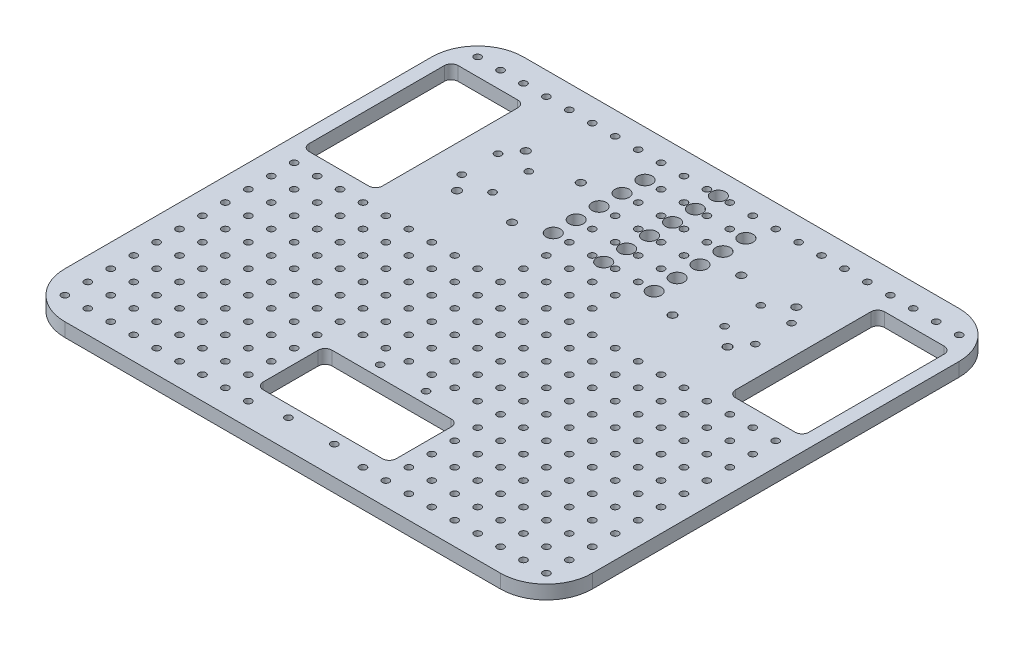
from build123d import *

# Parameters (mm, degrees)
SKETCH_1_W          = 230
SKETCH_1_H          = 200
SKETCH_1_R          = 1.73
EXTRUDE_1_DEPTH     = 6
FILLET_1_R          = 20
SKETCH_2_R          = 1.5
SKETCH_2_W          = 32
SKETCH_2_H          = 65
SKETCH_2_W_2        = 58
SKETCH_2_H_2        = 30
CUT_EXTRUDE_1_DEPTH = 10
FILLET_2_R          = 3
SKETCH_3_R          = 1.5
SKETCH_3_R_2        = 3.1
CUT_EXTRUDE_2_DEPTH = 10
SKETCH_4_R          = 1.5
CUT_EXTRUDE_3_DEPTH = 10


with BuildPart() as part:
    # Эскиз1 → Бобышка-Вытянуть1 (new body)
    with BuildSketch(Plane(origin=(0, 0, 0), x_dir=(1, 0, 0), z_dir=(0, 1, 0))):
        with Locations((115, 100)):
            Rectangle(SKETCH_1_W, SKETCH_1_H)
        with Locations((80, 135)):
            Circle(SKETCH_1_R, mode=Mode.SUBTRACT)
        with Locations((80, 165)):
            Circle(SKETCH_1_R, mode=Mode.SUBTRACT)
        with Locations((56, 165)):
            Circle(SKETCH_1_R, mode=Mode.SUBTRACT)
        with Locations((56, 135)):
            Circle(SKETCH_1_R, mode=Mode.SUBTRACT)
        with Locations((150, 135)):
            Circle(SKETCH_1_R, mode=Mode.SUBTRACT)
        with Locations((174, 135)):
            Circle(SKETCH_1_R, mode=Mode.SUBTRACT)
        with Locations((150, 165)):
            Circle(SKETCH_1_R, mode=Mode.SUBTRACT)
        with Locations((174, 165)):
            Circle(SKETCH_1_R, mode=Mode.SUBTRACT)
    extrude(amount=EXTRUDE_1_DEPTH)

    # Скругление1
    fillet_1_edges = [part.edges().sort_by_distance(p)[0] for p in [
        (0, 3, 0),
        (230, 3, 0),
        (230, 3, -200),
        (0, 3, -200),
    ]]
    fillet(fillet_1_edges, radius=FILLET_1_R)

    # Эскиз2 → Вырез-Вытянуть1 (cut)
    with BuildSketch(Plane(origin=(0, 6, 0), x_dir=(1, 0, 0), z_dir=(0, 1, 0))):
        with Locations((105, 12.5)):
            Circle(SKETCH_2_R)
        with Locations((125, 12.5)):
            Circle(SKETCH_2_R)
        with Locations((105, 52.5)):
            Circle(SKETCH_2_R)
        with Locations((125, 52.5)):
            Circle(SKETCH_2_R)
        with Locations((208, 150)):
            Rectangle(SKETCH_2_W, SKETCH_2_H)
        with Locations((22, 150)):
            Rectangle(SKETCH_2_W, SKETCH_2_H)
        with Locations((115, 32.5)):
            Rectangle(SKETCH_2_W_2, SKETCH_2_H_2)
    extrude(amount=-CUT_EXTRUDE_1_DEPTH, mode=Mode.SUBTRACT)

    # Скругление2
    fillet_2_edges = [part.edges().sort_by_distance(p)[0] for p in [
        (224, 3, -117.5),
        (224, 3, -182.5),
        (192, 3, -182.5),
        (192, 3, -117.5),
        (6, 3, -117.5),
        (38, 3, -117.5),
        (38, 3, -182.5),
        (6, 3, -182.5),
        (86, 3, -17.5),
        (144, 3, -17.5),
        (144, 3, -47.5),
        (86, 3, -47.5),
    ]]
    fillet(fillet_2_edges, radius=FILLET_2_R)

    # Эскиз3 → Вырез-Вытянуть2 (cut)
    with BuildSketch(Plane(origin=(0, 6, 0), x_dir=(1, 0, 0), z_dir=(0, 1, 0))):
        with Locations((10, 10)):
            Circle(SKETCH_3_R)
        with Locations((20, 10)):
            Circle(SKETCH_3_R)
        with Locations((30, 10)):
            Circle(SKETCH_3_R)
        with Locations((40, 10)):
            Circle(SKETCH_3_R)
        with Locations((50, 10)):
            Circle(SKETCH_3_R)
        with Locations((60, 10)):
            Circle(SKETCH_3_R)
        with Locations((70, 10)):
            Circle(SKETCH_3_R)
        with Locations((80, 10)):
            Circle(SKETCH_3_R)
        with Locations((90, 10)):
            Circle(SKETCH_3_R)
        with Locations((140, 10)):
            Circle(SKETCH_3_R)
        with Locations((150, 10)):
            Circle(SKETCH_3_R)
        with Locations((160, 10)):
            Circle(SKETCH_3_R)
        with Locations((170, 10)):
            Circle(SKETCH_3_R)
        with Locations((180, 10)):
            Circle(SKETCH_3_R)
        with Locations((190, 10)):
            Circle(SKETCH_3_R)
        with Locations((200, 10)):
            Circle(SKETCH_3_R)
        with Locations((210, 10)):
            Circle(SKETCH_3_R)
        with Locations((220, 10)):
            Circle(SKETCH_3_R)
        with Locations((20, 20)):
            Circle(SKETCH_3_R)
        with Locations((30, 20)):
            Circle(SKETCH_3_R)
        with Locations((40, 20)):
            Circle(SKETCH_3_R)
        with Locations((50, 20)):
            Circle(SKETCH_3_R)
        with Locations((60, 20)):
            Circle(SKETCH_3_R)
        with Locations((70, 20)):
            Circle(SKETCH_3_R)
        with Locations((80, 20)):
            Circle(SKETCH_3_R)
        with Locations((150, 20)):
            Circle(SKETCH_3_R)
        with Locations((160, 20)):
            Circle(SKETCH_3_R)
        with Locations((170, 20)):
            Circle(SKETCH_3_R)
        with Locations((180, 20)):
            Circle(SKETCH_3_R)
        with Locations((190, 20)):
            Circle(SKETCH_3_R)
        with Locations((200, 20)):
            Circle(SKETCH_3_R)
        with Locations((210, 20)):
            Circle(SKETCH_3_R)
        with Locations((220, 20)):
            Circle(SKETCH_3_R)
        with Locations((20, 30)):
            Circle(SKETCH_3_R)
        with Locations((30, 30)):
            Circle(SKETCH_3_R)
        with Locations((40, 30)):
            Circle(SKETCH_3_R)
        with Locations((50, 30)):
            Circle(SKETCH_3_R)
        with Locations((60, 30)):
            Circle(SKETCH_3_R)
        with Locations((70, 30)):
            Circle(SKETCH_3_R)
        with Locations((80, 30)):
            Circle(SKETCH_3_R)
        with Locations((150, 30)):
            Circle(SKETCH_3_R)
        with Locations((160, 30)):
            Circle(SKETCH_3_R)
        with Locations((170, 30)):
            Circle(SKETCH_3_R)
        with Locations((180, 30)):
            Circle(SKETCH_3_R)
        with Locations((190, 30)):
            Circle(SKETCH_3_R)
        with Locations((200, 30)):
            Circle(SKETCH_3_R)
        with Locations((210, 30)):
            Circle(SKETCH_3_R)
        with Locations((220, 30)):
            Circle(SKETCH_3_R)
        with Locations((20, 40)):
            Circle(SKETCH_3_R)
        with Locations((30, 40)):
            Circle(SKETCH_3_R)
        with Locations((40, 40)):
            Circle(SKETCH_3_R)
        with Locations((50, 40)):
            Circle(SKETCH_3_R)
        with Locations((60, 40)):
            Circle(SKETCH_3_R)
        with Locations((70, 40)):
            Circle(SKETCH_3_R)
        with Locations((80, 40)):
            Circle(SKETCH_3_R)
        with Locations((150, 40)):
            Circle(SKETCH_3_R)
        with Locations((160, 40)):
            Circle(SKETCH_3_R)
        with Locations((170, 40)):
            Circle(SKETCH_3_R)
        with Locations((180, 40)):
            Circle(SKETCH_3_R)
        with Locations((190, 40)):
            Circle(SKETCH_3_R)
        with Locations((200, 40)):
            Circle(SKETCH_3_R)
        with Locations((210, 40)):
            Circle(SKETCH_3_R)
        with Locations((220, 40)):
            Circle(SKETCH_3_R)
        with Locations((20, 50)):
            Circle(SKETCH_3_R)
        with Locations((30, 50)):
            Circle(SKETCH_3_R)
        with Locations((40, 50)):
            Circle(SKETCH_3_R)
        with Locations((50, 50)):
            Circle(SKETCH_3_R)
        with Locations((60, 50)):
            Circle(SKETCH_3_R)
        with Locations((70, 50)):
            Circle(SKETCH_3_R)
        with Locations((80, 50)):
            Circle(SKETCH_3_R)
        with Locations((150, 50)):
            Circle(SKETCH_3_R)
        with Locations((160, 50)):
            Circle(SKETCH_3_R)
        with Locations((170, 50)):
            Circle(SKETCH_3_R)
        with Locations((180, 50)):
            Circle(SKETCH_3_R)
        with Locations((190, 50)):
            Circle(SKETCH_3_R)
        with Locations((200, 50)):
            Circle(SKETCH_3_R)
        with Locations((210, 50)):
            Circle(SKETCH_3_R)
        with Locations((220, 50)):
            Circle(SKETCH_3_R)
        with Locations((20, 60)):
            Circle(SKETCH_3_R)
        with Locations((30, 60)):
            Circle(SKETCH_3_R)
        with Locations((40, 60)):
            Circle(SKETCH_3_R)
        with Locations((50, 60)):
            Circle(SKETCH_3_R)
        with Locations((60, 60)):
            Circle(SKETCH_3_R)
        with Locations((70, 60)):
            Circle(SKETCH_3_R)
        with Locations((80, 60)):
            Circle(SKETCH_3_R)
        with Locations((90, 60)):
            Circle(SKETCH_3_R)
        with Locations((100, 60)):
            Circle(SKETCH_3_R)
        with Locations((110, 60)):
            Circle(SKETCH_3_R)
        with Locations((120, 60)):
            Circle(SKETCH_3_R)
        with Locations((130, 60)):
            Circle(SKETCH_3_R)
        with Locations((140, 60)):
            Circle(SKETCH_3_R)
        with Locations((150, 60)):
            Circle(SKETCH_3_R)
        with Locations((160, 60)):
            Circle(SKETCH_3_R)
        with Locations((170, 60)):
            Circle(SKETCH_3_R)
        with Locations((180, 60)):
            Circle(SKETCH_3_R)
        with Locations((190, 60)):
            Circle(SKETCH_3_R)
        with Locations((200, 60)):
            Circle(SKETCH_3_R)
        with Locations((210, 60)):
            Circle(SKETCH_3_R)
        with Locations((220, 60)):
            Circle(SKETCH_3_R)
        with Locations((20, 70)):
            Circle(SKETCH_3_R)
        with Locations((30, 70)):
            Circle(SKETCH_3_R)
        with Locations((40, 70)):
            Circle(SKETCH_3_R)
        with Locations((50, 70)):
            Circle(SKETCH_3_R)
        with Locations((60, 70)):
            Circle(SKETCH_3_R)
        with Locations((70, 70)):
            Circle(SKETCH_3_R)
        with Locations((80, 70)):
            Circle(SKETCH_3_R)
        with Locations((90, 70)):
            Circle(SKETCH_3_R)
        with Locations((100, 70)):
            Circle(SKETCH_3_R)
        with Locations((110, 70)):
            Circle(SKETCH_3_R)
        with Locations((120, 70)):
            Circle(SKETCH_3_R)
        with Locations((130, 70)):
            Circle(SKETCH_3_R)
        with Locations((140, 70)):
            Circle(SKETCH_3_R)
        with Locations((150, 70)):
            Circle(SKETCH_3_R)
        with Locations((160, 70)):
            Circle(SKETCH_3_R)
        with Locations((170, 70)):
            Circle(SKETCH_3_R)
        with Locations((180, 70)):
            Circle(SKETCH_3_R)
        with Locations((190, 70)):
            Circle(SKETCH_3_R)
        with Locations((200, 70)):
            Circle(SKETCH_3_R)
        with Locations((210, 70)):
            Circle(SKETCH_3_R)
        with Locations((220, 70)):
            Circle(SKETCH_3_R)
        with Locations((20, 80)):
            Circle(SKETCH_3_R)
        with Locations((30, 80)):
            Circle(SKETCH_3_R)
        with Locations((40, 80)):
            Circle(SKETCH_3_R)
        with Locations((50, 80)):
            Circle(SKETCH_3_R)
        with Locations((60, 80)):
            Circle(SKETCH_3_R)
        with Locations((70, 80)):
            Circle(SKETCH_3_R)
        with Locations((80, 80)):
            Circle(SKETCH_3_R)
        with Locations((90, 80)):
            Circle(SKETCH_3_R)
        with Locations((100, 80)):
            Circle(SKETCH_3_R)
        with Locations((110, 80)):
            Circle(SKETCH_3_R)
        with Locations((120, 80)):
            Circle(SKETCH_3_R)
        with Locations((130, 80)):
            Circle(SKETCH_3_R)
        with Locations((140, 80)):
            Circle(SKETCH_3_R)
        with Locations((150, 80)):
            Circle(SKETCH_3_R)
        with Locations((160, 80)):
            Circle(SKETCH_3_R)
        with Locations((170, 80)):
            Circle(SKETCH_3_R)
        with Locations((180, 80)):
            Circle(SKETCH_3_R)
        with Locations((190, 80)):
            Circle(SKETCH_3_R)
        with Locations((200, 80)):
            Circle(SKETCH_3_R)
        with Locations((210, 80)):
            Circle(SKETCH_3_R)
        with Locations((220, 80)):
            Circle(SKETCH_3_R)
        with Locations((20, 90)):
            Circle(SKETCH_3_R)
        with Locations((30, 90)):
            Circle(SKETCH_3_R)
        with Locations((40, 90)):
            Circle(SKETCH_3_R)
        with Locations((50, 90)):
            Circle(SKETCH_3_R)
        with Locations((60, 90)):
            Circle(SKETCH_3_R)
        with Locations((70, 90)):
            Circle(SKETCH_3_R)
        with Locations((80, 90)):
            Circle(SKETCH_3_R)
        with Locations((90, 90)):
            Circle(SKETCH_3_R)
        with Locations((100, 90)):
            Circle(SKETCH_3_R)
        with Locations((110, 90)):
            Circle(SKETCH_3_R)
        with Locations((120, 90)):
            Circle(SKETCH_3_R)
        with Locations((130, 90)):
            Circle(SKETCH_3_R)
        with Locations((140, 90)):
            Circle(SKETCH_3_R)
        with Locations((150, 90)):
            Circle(SKETCH_3_R)
        with Locations((160, 90)):
            Circle(SKETCH_3_R)
        with Locations((170, 90)):
            Circle(SKETCH_3_R)
        with Locations((180, 90)):
            Circle(SKETCH_3_R)
        with Locations((190, 90)):
            Circle(SKETCH_3_R)
        with Locations((200, 90)):
            Circle(SKETCH_3_R)
        with Locations((210, 90)):
            Circle(SKETCH_3_R)
        with Locations((220, 90)):
            Circle(SKETCH_3_R)
        with Locations((20, 100)):
            Circle(SKETCH_3_R)
        with Locations((30, 100)):
            Circle(SKETCH_3_R)
        with Locations((40, 100)):
            Circle(SKETCH_3_R)
        with Locations((50, 100)):
            Circle(SKETCH_3_R)
        with Locations((60, 100)):
            Circle(SKETCH_3_R)
        with Locations((70, 100)):
            Circle(SKETCH_3_R)
        with Locations((80, 100)):
            Circle(SKETCH_3_R)
        with Locations((90, 100)):
            Circle(SKETCH_3_R)
        with Locations((100, 100)):
            Circle(SKETCH_3_R)
        with Locations((110, 100)):
            Circle(SKETCH_3_R)
        with Locations((120, 100)):
            Circle(SKETCH_3_R)
        with Locations((130, 100)):
            Circle(SKETCH_3_R)
        with Locations((140, 100)):
            Circle(SKETCH_3_R)
        with Locations((150, 100)):
            Circle(SKETCH_3_R)
        with Locations((160, 100)):
            Circle(SKETCH_3_R)
        with Locations((170, 100)):
            Circle(SKETCH_3_R)
        with Locations((180, 100)):
            Circle(SKETCH_3_R)
        with Locations((190, 100)):
            Circle(SKETCH_3_R)
        with Locations((200, 100)):
            Circle(SKETCH_3_R)
        with Locations((210, 100)):
            Circle(SKETCH_3_R)
        with Locations((220, 100)):
            Circle(SKETCH_3_R)
        with Locations((20, 110)):
            Circle(SKETCH_3_R)
        with Locations((30, 110)):
            Circle(SKETCH_3_R)
        with Locations((40, 110)):
            Circle(SKETCH_3_R)
        with Locations((50, 110)):
            Circle(SKETCH_3_R)
        with Locations((60, 110)):
            Circle(SKETCH_3_R)
        with Locations((70, 110)):
            Circle(SKETCH_3_R)
        with Locations((80, 110)):
            Circle(SKETCH_3_R)
        with Locations((90, 110)):
            Circle(SKETCH_3_R)
        with Locations((100, 110)):
            Circle(SKETCH_3_R)
        with Locations((110, 110)):
            Circle(SKETCH_3_R)
        with Locations((120, 110)):
            Circle(SKETCH_3_R)
        with Locations((130, 110)):
            Circle(SKETCH_3_R)
        with Locations((140, 110)):
            Circle(SKETCH_3_R)
        with Locations((150, 110)):
            Circle(SKETCH_3_R)
        with Locations((160, 110)):
            Circle(SKETCH_3_R)
        with Locations((170, 110)):
            Circle(SKETCH_3_R)
        with Locations((180, 110)):
            Circle(SKETCH_3_R)
        with Locations((190, 110)):
            Circle(SKETCH_3_R)
        with Locations((200, 110)):
            Circle(SKETCH_3_R)
        with Locations((210, 110)):
            Circle(SKETCH_3_R)
        with Locations((220, 110)):
            Circle(SKETCH_3_R)
        with Locations((100, 120)):
            Circle(SKETCH_3_R)
        with Locations((110, 120)):
            Circle(SKETCH_3_R)
        with Locations((120, 120)):
            Circle(SKETCH_3_R)
        with Locations((130, 120)):
            Circle(SKETCH_3_R)
        with Locations((100, 130)):
            Circle(SKETCH_3_R)
        with Locations((110, 130)):
            Circle(SKETCH_3_R)
        with Locations((120, 130)):
            Circle(SKETCH_3_R)
        with Locations((130, 130)):
            Circle(SKETCH_3_R)
        with Locations((100, 140)):
            Circle(SKETCH_3_R)
        with Locations((110, 140)):
            Circle(SKETCH_3_R)
        with Locations((120, 140)):
            Circle(SKETCH_3_R)
        with Locations((130, 140)):
            Circle(SKETCH_3_R)
        with Locations((100, 150)):
            Circle(SKETCH_3_R)
        with Locations((110, 150)):
            Circle(SKETCH_3_R)
        with Locations((120, 150)):
            Circle(SKETCH_3_R)
        with Locations((130, 150)):
            Circle(SKETCH_3_R)
        with Locations((100, 160)):
            Circle(SKETCH_3_R)
        with Locations((110, 160)):
            Circle(SKETCH_3_R)
        with Locations((120, 160)):
            Circle(SKETCH_3_R)
        with Locations((130, 160)):
            Circle(SKETCH_3_R)
        with Locations((100, 170)):
            Circle(SKETCH_3_R)
        with Locations((110, 170)):
            Circle(SKETCH_3_R)
        with Locations((120, 170)):
            Circle(SKETCH_3_R)
        with Locations((130, 170)):
            Circle(SKETCH_3_R)
        with Locations((100, 180)):
            Circle(SKETCH_3_R)
        with Locations((110, 180)):
            Circle(SKETCH_3_R)
        with Locations((120, 180)):
            Circle(SKETCH_3_R)
        with Locations((130, 180)):
            Circle(SKETCH_3_R)
        with Locations((20, 190)):
            Circle(SKETCH_3_R)
        with Locations((30, 190)):
            Circle(SKETCH_3_R)
        with Locations((40, 190)):
            Circle(SKETCH_3_R)
        with Locations((50, 190)):
            Circle(SKETCH_3_R)
        with Locations((60, 190)):
            Circle(SKETCH_3_R)
        with Locations((70, 190)):
            Circle(SKETCH_3_R)
        with Locations((80, 190)):
            Circle(SKETCH_3_R)
        with Locations((90, 190)):
            Circle(SKETCH_3_R)
        with Locations((100, 190)):
            Circle(SKETCH_3_R)
        with Locations((110, 190)):
            Circle(SKETCH_3_R)
        with Locations((120, 190)):
            Circle(SKETCH_3_R)
        with Locations((130, 190)):
            Circle(SKETCH_3_R)
        with Locations((140, 190)):
            Circle(SKETCH_3_R)
        with Locations((150, 190)):
            Circle(SKETCH_3_R)
        with Locations((160, 190)):
            Circle(SKETCH_3_R)
        with Locations((170, 190)):
            Circle(SKETCH_3_R)
        with Locations((180, 190)):
            Circle(SKETCH_3_R)
        with Locations((190, 190)):
            Circle(SKETCH_3_R)
        with Locations((200, 190)):
            Circle(SKETCH_3_R)
        with Locations((210, 190)):
            Circle(SKETCH_3_R)
        with Locations((220, 190)):
            Circle(SKETCH_3_R)
        with Locations((10, 20)):
            Circle(SKETCH_3_R)
        with Locations((10, 30)):
            Circle(SKETCH_3_R)
        with Locations((10, 40)):
            Circle(SKETCH_3_R)
        with Locations((10, 50)):
            Circle(SKETCH_3_R)
        with Locations((10, 60)):
            Circle(SKETCH_3_R)
        with Locations((10, 70)):
            Circle(SKETCH_3_R)
        with Locations((10, 80)):
            Circle(SKETCH_3_R)
        with Locations((10, 90)):
            Circle(SKETCH_3_R)
        with Locations((10, 100)):
            Circle(SKETCH_3_R)
        with Locations((10, 110)):
            Circle(SKETCH_3_R)
        with Locations((10, 190)):
            Circle(SKETCH_3_R)
        with Locations((115, 190)):
            Circle(SKETCH_3_R_2)
        with Locations((115, 180)):
            Circle(SKETCH_3_R_2)
        with Locations((115, 170)):
            Circle(SKETCH_3_R_2)
        with Locations((115, 160)):
            Circle(SKETCH_3_R_2)
        with Locations((115, 150)):
            Circle(SKETCH_3_R_2)
        with Locations((115, 140)):
            Circle(SKETCH_3_R_2)
        with Locations((137, 180)):
            Circle(SKETCH_3_R_2)
        with Locations((93, 180)):
            Circle(SKETCH_3_R_2)
        with Locations((93, 170)):
            Circle(SKETCH_3_R_2)
        with Locations((137, 170)):
            Circle(SKETCH_3_R_2)
        with Locations((93, 160)):
            Circle(SKETCH_3_R_2)
        with Locations((137, 160)):
            Circle(SKETCH_3_R_2)
        with Locations((93, 150)):
            Circle(SKETCH_3_R_2)
        with Locations((137, 150)):
            Circle(SKETCH_3_R_2)
        with Locations((93, 140)):
            Circle(SKETCH_3_R_2)
        with Locations((137, 140)):
            Circle(SKETCH_3_R_2)
    extrude(amount=-CUT_EXTRUDE_2_DEPTH, mode=Mode.SUBTRACT)

    # Эскиз4 → Вырез-Вытянуть3 (cut)
    with BuildSketch(Plane(origin=(0, 6, 0), x_dir=(1, 0, 0), z_dir=(0, 1, 0))):
        with Locations((51, 157.9)):
            Circle(SKETCH_4_R)
        with Locations((64.4, 157.9)):
            Circle(SKETCH_4_R)
        with Locations((64.4, 142.1)):
            Circle(SKETCH_4_R)
        with Locations((51, 142.1)):
            Circle(SKETCH_4_R)
        with Locations((179, 142.1)):
            Circle(SKETCH_4_R)
        with Locations((165.6, 142.1)):
            Circle(SKETCH_4_R)
        with Locations((165.6, 157.9)):
            Circle(SKETCH_4_R)
        with Locations((179, 157.9)):
            Circle(SKETCH_4_R)
    extrude(amount=-CUT_EXTRUDE_3_DEPTH, mode=Mode.SUBTRACT)


solid = part.part
